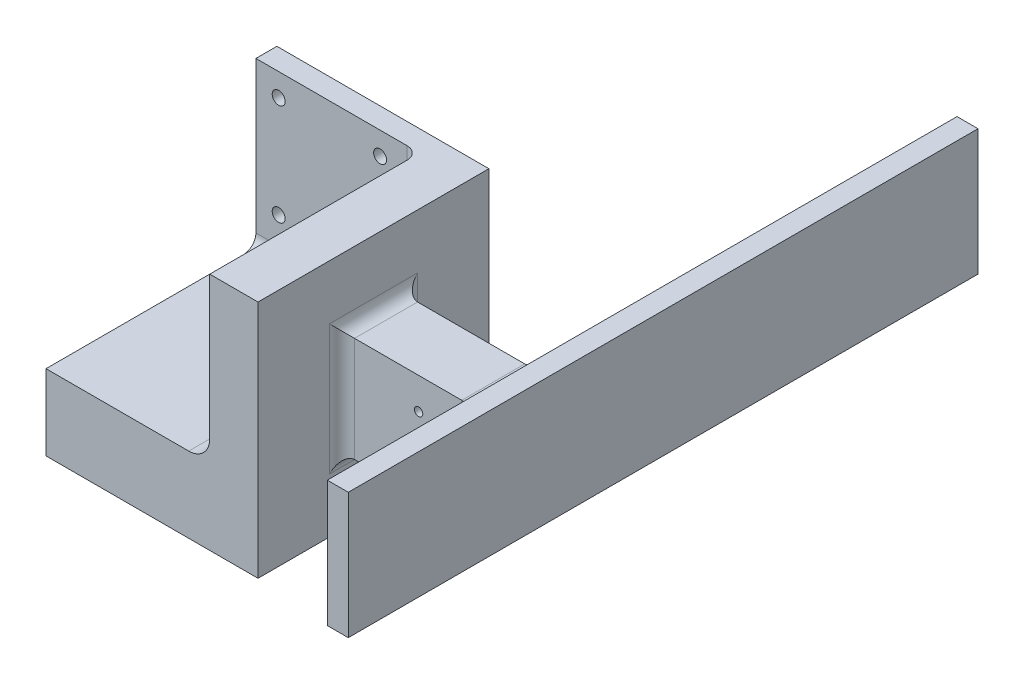
from build123d import *

# Parameters (mm, degrees)
SKETCH1_R                = 1.542
BOSS_EXTRUDE1_DEPTH      = 5
BOSS_EXTRUDE4_DEPTH      = 50
BOSS_EXTRUDE4_DEPTH_BACK = 5
FILLET3_R                = 3
FILLET4_R                = 5
BOSS_EXTRUDE5_DEPTH      = 55
SKETCH7_W                = 15
SKETCH7_H                = 25
BOSS_EXTRUDE6_DEPTH      = 36.5
SKETCH8_R                = 1
CUT_EXTRUDE1_DEPTH       = 88.266832187
SKETCH9_W                = 150
SKETCH9_H                = 30
BOSS_EXTRUDE7_DEPTH      = 5
FILLET5_R                = 3
FILLET6_R                = 3


with BuildPart() as part:
    # Sketch1 → Boss-Extrude1 (new body)
    with BuildSketch(Plane.XY):
        Polygon((-17.5, 17.5), (17.5, 17.5), (21.5, 17.5), (21.5, -21.5), (17.5, -21.5), (-17.5, -21.5), (-17.5, -17.5), align=None)
        with Locations((-12.078444483, 12.078444483)):
            Circle(SKETCH1_R, mode=Mode.SUBTRACT)
        with Locations(Location((12.078444483, 12.078444483, 0), (0, 0, 180))):
            Circle(SKETCH1_R, mode=Mode.SUBTRACT)
        with Locations((12.078444483, -12.078444483)):
            Circle(SKETCH1_R, mode=Mode.SUBTRACT)
        with Locations(Location((-12.078444483, -12.078444483, 0), (0, 0, 180))):
            Circle(SKETCH1_R, mode=Mode.SUBTRACT)
    extrude(amount=BOSS_EXTRUDE1_DEPTH)

    # Sketch4 → Boss-Extrude4 (add, two sides: drawn at the far end of the back side and taken through both)
    with BuildSketch(Plane.XY.offset(5).offset(-BOSS_EXTRUDE4_DEPTH_BACK)):
        Polygon((21.5, 17.5), (26, 17.5), (26, -26), (-17.5, -26), (-17.5, -21.5), (21.5, -21.5), align=None)
    extrude(amount=BOSS_EXTRUDE4_DEPTH + BOSS_EXTRUDE4_DEPTH_BACK)

    # Fillet3
    fillet3_edges = [part.edges().sort_by_distance(p)[0] for p in [
        (2, -21.5, 5),
        (21.5, -2, 5),
    ]]
    fillet(fillet3_edges, radius=FILLET3_R)

    # Fillet4
    # the kernel refuses this fillet: 5 mm, written as the material it adds along each edge
    with BuildSketch(Plane(origin=(16.5, -16.5, 5), x_dir=(1, 0, 0), z_dir=(0, 1, 0))) as fillet4_piece_1:
        with BuildLine():
            CenterArc((2, -3), 3, 0, 90)
            Line((5, -3), (5, 0))
            Line((5, 0), (2, 0))
        make_face()
    revolve(axis=Axis((16.5, -16.5, 5), (0, 0, -1)), revolution_arc=90)
    with BuildSketch(Plane(origin=(21.5, -21.5, 5), x_dir=(0, 1, 0), z_dir=(0, 0, 1))) as fillet4_piece_2:
        with BuildLine():
            CenterArc((FILLET4_R, FILLET4_R), FILLET4_R, 180, 90)
            Line((0, FILLET4_R), (0, 0))
            Line((0, 0), (FILLET4_R, 0))
        make_face()
    extrude(amount=50)

    # Sketch6 → Boss-Extrude5 (add, through all)
    with BuildSketch(Plane.XY.offset(55)):
        Polygon((-17.5, -26), (26, -26), (26, 17.5), (33, 17.5), (33, -39.5), (26, -39.5), (-17.5, -39.5), align=None)
    extrude(amount=-BOSS_EXTRUDE5_DEPTH)

    # Sketch7 → Boss-Extrude6 (add)
    with BuildSketch(Plane(origin=(33, 0, 0), x_dir=(0, 0, -1), z_dir=(1, 0, 0))):
        with Locations((-27.5, -11)):
            Rectangle(SKETCH7_W, SKETCH7_H)
    extrude(amount=BOSS_EXTRUDE6_DEPTH)

    # Sketch8 → Cut-Extrude1 (cut, through all)
    with BuildSketch(Plane.XY.offset(35)):
        with Locations((51.25, -11)):
            Circle(SKETCH8_R)
        with Locations((51.25, -16)):
            Circle(SKETCH8_R)
        with Locations((51.25, -6)):
            Circle(SKETCH8_R)
    extrude(amount=-CUT_EXTRUDE1_DEPTH, mode=Mode.SUBTRACT)

    # Sketch9 → Boss-Extrude7 (add)
    with BuildSketch(Plane(origin=(69.5, 0, 0), x_dir=(0, 0, -1), z_dir=(1, 0, 0))):
        with Locations((5, -11)):
            Rectangle(SKETCH9_W, SKETCH9_H)
    extrude(amount=-BOSS_EXTRUDE7_DEPTH)

    # Fillet5
    # the kernel refuses this fillet: 3 mm, written as the material it adds along each edge
    with BuildSketch(Plane(origin=(64.5, -23.5, 35), x_dir=(-1, 0, 0), z_dir=(0, 0, -1)), Plane(origin=(64.5, 1.5, 20), x_dir=(-1, 0, 0), z_dir=(0, 0, 1))) as fillet5_piece_1:
        with BuildLine():
            CenterArc((2.958039892, -3), FILLET5_R, 90, 80.405931773)
            Line((0, -2.5), (-0.059160798, -2.49))
            ThreePointArc((-0.059160798, -2.49), (-0.06, -1.25), (-0.06, 0))
            Line((-0.06, 0), (0, 0.06))
            Line((0, 0.06), (2.958039892, 0.06))
            Line((2.958039892, 0.06), (2.958039892, 0))
        make_face()
    extrude(amount=15)
    with BuildSketch(Plane(origin=(64.5, -23.5, 20), x_dir=(-1, 0, 0), z_dir=(0, 1, 0)), Plane(origin=(64.5, 1.5, 35), x_dir=(-1, 0, 0), z_dir=(0, -1, 0))) as fillet5_piece_2:
        with BuildLine():
            CenterArc((FILLET5_R, -FILLET5_R), FILLET5_R, 90, 90)
            Line((0, -FILLET5_R), (-FILLET5_R * 0.02, -FILLET5_R))
            Line((-FILLET5_R * 0.02, -FILLET5_R), (-FILLET5_R * 0.02, FILLET5_R * 0.02))
            Line((-FILLET5_R * 0.02, FILLET5_R * 0.02), (FILLET5_R, FILLET5_R * 0.02))
            Line((FILLET5_R, FILLET5_R * 0.02), (FILLET5_R, 0))
        make_face()
    extrude(amount=25)
    with BuildSketch(Plane(origin=(64.5, -23.5, 42.395099729), x_dir=(-1, 0, 0), z_dir=(0, 0, -1))) as fillet5_piece_3a_section:
        with BuildLine():
            CenterArc((2.958039892, -3), FILLET5_R, 90, 80.405931773)
            Line((0, -2.5), (-0.059160798, -2.49))
            ThreePointArc((-0.059160798, -2.49), (-0.06, -1.25), (-0.06, 0))
            Line((-0.06, 0), (0, 0.06))
            Line((0, 0.06), (2.958039892, 0.06))
            Line((2.958039892, 0.06), (2.958039892, 0))
        make_face()
    fillet5_piece_3a = extrude(amount=22.395099729, mode=Mode.PRIVATE)
    fillet5_piece_3a = split(fillet5_piece_3a, bisect_by=Plane(origin=(63.81401797, -24.116958935, 35), z_dir=(0, 0, 1)), keep=Keep.TOP, mode=Mode.PRIVATE)
    with BuildSketch(Plane(origin=(64.5, 1.5, 35), x_dir=(-1, 0, 0), z_dir=(0, -1, 0))) as fillet5_piece_3b_section:
        with BuildLine():
            CenterArc((FILLET5_R, -FILLET5_R), FILLET5_R, 90, 90)
            Line((0, -FILLET5_R), (-FILLET5_R * 0.02, -FILLET5_R))
            Line((-FILLET5_R * 0.02, -FILLET5_R), (-FILLET5_R * 0.02, FILLET5_R * 0.02))
            Line((-FILLET5_R * 0.02, FILLET5_R * 0.02), (FILLET5_R, FILLET5_R * 0.02))
            Line((FILLET5_R, FILLET5_R * 0.02), (FILLET5_R, 0))
        make_face()
    fillet5_piece_3b = extrude(amount=32.5, mode=Mode.PRIVATE)
    fillet5_piece_3b = split(fillet5_piece_3b, bisect_by=Plane(origin=(63.820814657, -23.5, 35.679185343), z_dir=(0, -1, 0)), keep=Keep.TOP, mode=Mode.PRIVATE)
    fillet5_piece_3b = split(fillet5_piece_3b, bisect_by=Plane(origin=(63.820814657, -26, 35.679185343), z_dir=(0, 1, 0)), keep=Keep.TOP, mode=Mode.PRIVATE)
    fillet5_piece_3 = fillet5_piece_3a & fillet5_piece_3b
    add(fillet5_piece_3)
    with BuildSketch(Plane(origin=(64.5, -31, 20), x_dir=(-1, 0, 0), z_dir=(0, 1, 0))) as fillet5_piece_4a_section:
        with BuildLine():
            CenterArc((FILLET5_R, -FILLET5_R), FILLET5_R, 90, 90)
            Line((0, -FILLET5_R), (-FILLET5_R * 0.02, -FILLET5_R))
            Line((-FILLET5_R * 0.02, -FILLET5_R), (-FILLET5_R * 0.02, FILLET5_R * 0.02))
            Line((-FILLET5_R * 0.02, FILLET5_R * 0.02), (FILLET5_R, FILLET5_R * 0.02))
            Line((FILLET5_R, FILLET5_R * 0.02), (FILLET5_R, 0))
        make_face()
    fillet5_piece_4a = extrude(amount=32.5, mode=Mode.PRIVATE)
    fillet5_piece_4a = split(fillet5_piece_4a, bisect_by=Plane(origin=(63.820814657, -23.5, 19.320814657), z_dir=(0, -1, 0)), keep=Keep.TOP, mode=Mode.PRIVATE)
    fillet5_piece_4a = split(fillet5_piece_4a, bisect_by=Plane(origin=(63.820814657, -26, 19.320814657), z_dir=(0, 1, 0)), keep=Keep.TOP, mode=Mode.PRIVATE)
    with BuildSketch(Plane(origin=(64.5, -23.5, 35), x_dir=(-1, 0, 0), z_dir=(0, 0, -1))) as fillet5_piece_4b_section:
        with BuildLine():
            CenterArc((2.958039892, -3), FILLET5_R, 90, 80.405931773)
            Line((0, -2.5), (-0.059160798, -2.49))
            ThreePointArc((-0.059160798, -2.49), (-0.06, -1.25), (-0.06, 0))
            Line((-0.06, 0), (0, 0.06))
            Line((0, 0.06), (2.958039892, 0.06))
            Line((2.958039892, 0.06), (2.958039892, 0))
        make_face()
    fillet5_piece_4b = extrude(amount=22.395099729, mode=Mode.PRIVATE)
    fillet5_piece_4b = split(fillet5_piece_4b, bisect_by=Plane(origin=(63.81401797, -24.116958935, 20), z_dir=(0, 0, -1)), keep=Keep.TOP, mode=Mode.PRIVATE)
    fillet5_piece_4 = fillet5_piece_4a & fillet5_piece_4b
    add(fillet5_piece_4)
    with BuildSketch(Plane(origin=(64.5, 1.5, 12.604900271), x_dir=(-1, 0, 0), z_dir=(0, 0, 1))) as fillet5_piece_5a_section:
        with BuildLine():
            CenterArc((2.958039892, -3), FILLET5_R, 90, 80.405931773)
            Line((0, -2.5), (-0.059160798, -2.49))
            ThreePointArc((-0.059160798, -2.49), (-0.06, -1.25), (-0.06, 0))
            Line((-0.06, 0), (0, 0.06))
            Line((0, 0.06), (2.958039892, 0.06))
            Line((2.958039892, 0.06), (2.958039892, 0))
        make_face()
    fillet5_piece_5a = extrude(amount=22.395099729, mode=Mode.PRIVATE)
    fillet5_piece_5a = split(fillet5_piece_5a, bisect_by=Plane(origin=(63.81401797, 2.116958935, 20), z_dir=(0, 0, -1)), keep=Keep.TOP, mode=Mode.PRIVATE)
    with BuildSketch(Plane(origin=(64.5, -23.5, 20), x_dir=(-1, 0, 0), z_dir=(0, 1, 0))) as fillet5_piece_5b_section:
        with BuildLine():
            CenterArc((FILLET5_R, -FILLET5_R), FILLET5_R, 90, 90)
            Line((0, -FILLET5_R), (-FILLET5_R * 0.02, -FILLET5_R))
            Line((-FILLET5_R * 0.02, -FILLET5_R), (-FILLET5_R * 0.02, FILLET5_R * 0.02))
            Line((-FILLET5_R * 0.02, FILLET5_R * 0.02), (FILLET5_R, FILLET5_R * 0.02))
            Line((FILLET5_R, FILLET5_R * 0.02), (FILLET5_R, 0))
        make_face()
    fillet5_piece_5b = extrude(amount=32.5, mode=Mode.PRIVATE)
    fillet5_piece_5b = split(fillet5_piece_5b, bisect_by=Plane(origin=(63.820814657, 1.5, 19.320814657), z_dir=(0, 1, 0)), keep=Keep.TOP, mode=Mode.PRIVATE)
    fillet5_piece_5b = split(fillet5_piece_5b, bisect_by=Plane(origin=(63.820814657, 4, 19.320814657), z_dir=(0, -1, 0)), keep=Keep.TOP, mode=Mode.PRIVATE)
    fillet5_piece_5 = fillet5_piece_5a & fillet5_piece_5b
    add(fillet5_piece_5)
    with BuildSketch(Plane(origin=(64.5, 1.5, 20), x_dir=(-1, 0, 0), z_dir=(0, 0, 1))) as fillet5_piece_6a_section:
        with BuildLine():
            CenterArc((2.958039892, -3), FILLET5_R, 90, 80.405931773)
            Line((0, -2.5), (-0.059160798, -2.49))
            ThreePointArc((-0.059160798, -2.49), (-0.06, -1.25), (-0.06, 0))
            Line((-0.06, 0), (0, 0.06))
            Line((0, 0.06), (2.958039892, 0.06))
            Line((2.958039892, 0.06), (2.958039892, 0))
        make_face()
    fillet5_piece_6a = extrude(amount=22.395099729, mode=Mode.PRIVATE)
    fillet5_piece_6a = split(fillet5_piece_6a, bisect_by=Plane(origin=(63.81401797, 2.116958935, 35), z_dir=(0, 0, 1)), keep=Keep.TOP, mode=Mode.PRIVATE)
    with BuildSketch(Plane(origin=(64.5, 9, 35), x_dir=(-1, 0, 0), z_dir=(0, -1, 0))) as fillet5_piece_6b_section:
        with BuildLine():
            CenterArc((FILLET5_R, -FILLET5_R), FILLET5_R, 90, 90)
            Line((0, -FILLET5_R), (-FILLET5_R * 0.02, -FILLET5_R))
            Line((-FILLET5_R * 0.02, -FILLET5_R), (-FILLET5_R * 0.02, FILLET5_R * 0.02))
            Line((-FILLET5_R * 0.02, FILLET5_R * 0.02), (FILLET5_R, FILLET5_R * 0.02))
            Line((FILLET5_R, FILLET5_R * 0.02), (FILLET5_R, 0))
        make_face()
    fillet5_piece_6b = extrude(amount=32.5, mode=Mode.PRIVATE)
    fillet5_piece_6b = split(fillet5_piece_6b, bisect_by=Plane(origin=(63.820814657, 1.5, 35.679185343), z_dir=(0, 1, 0)), keep=Keep.TOP, mode=Mode.PRIVATE)
    fillet5_piece_6b = split(fillet5_piece_6b, bisect_by=Plane(origin=(63.820814657, 4, 35.679185343), z_dir=(0, -1, 0)), keep=Keep.TOP, mode=Mode.PRIVATE)
    fillet5_piece_6 = fillet5_piece_6a & fillet5_piece_6b
    add(fillet5_piece_6)

    # Fillet6
    fillet6_edges = [part.edges().sort_by_distance(p)[0] for p in [
        (33, -11, 20),
        (33, 1.5, 27.5),
        (33, -11, 35),
        (33, -23.5, 27.5),
    ]]
    fillet(fillet6_edges, radius=FILLET6_R)


solid = part.part
